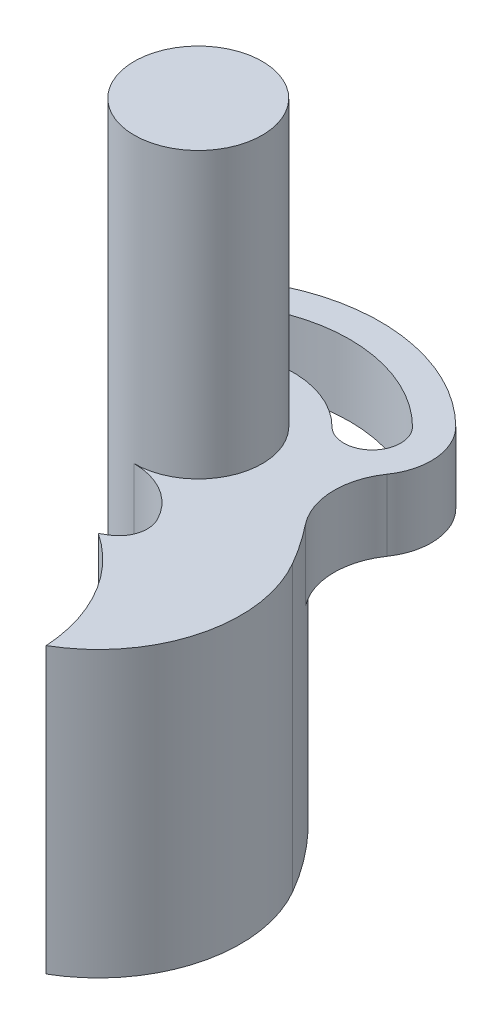
from build123d import *

# Parameters (mm, degrees)
SALIENTE_EXTRUIR1_DEPTH = 20
REDONDEO1_R             = 10
SALIENTE_EXTRUIR2_START = 20
CROQUIS1_4_R            = 4.5
SALIENTE_EXTRUIR2_DEPTH = 20
SALIENTE_EXTRUIR4_DEPTH = 5
REDONDEO4_R             = 5
REDONDEO5_R             = 2


with BuildPart() as part:
    # Croquis1 → Saliente-Extruir1 (new body)
    with BuildSketch(Plane(origin=(0, 0, 0), x_dir=(1, 0, 0), z_dir=(0, 1, 0))):
        with BuildLine():
            Line((4.71210557073282, 8.494038111608782), (2.980054763163943, 7.494038111608782))
            ThreePointArc((2.9800547631639436, 7.494038111608781), (6.495190528383288, 3.749999999999996), (7.9800547631639365, -1.1662159262356018))
            Line((7.980054763163938, -1.166215926235604), (16.640308801008324, 3.8337840737643942))
            Line((16.640308801008324, 3.833784073764395), (11.640308801008324, 12.49403811160878))
            ThreePointArc((11.640308801008327, 12.494038111608782), (7.486283619207324, 17.729429010253995), (1.992335720896067, 21.53492235058391))
            ThreePointArc((1.9923357208960657, 21.534922350583905), (-4.3821884132033615, 18.52294902668032), (2.49e-15, 13))
            ThreePointArc((4.3e-16, 13), (3.259893842188938, 11.692210023771297), (4.712105570732819, 8.494038111608784))
        make_face()
    extrude(amount=-SALIENTE_EXTRUIR1_DEPTH)

    # Redondeo1
    redondeo1_edges = [part.edges().sort_by_distance(p)[0] for p in [
        (16.640308801008324, -10, -3.8337840737643947),
    ]]
    fillet(redondeo1_edges, radius=REDONDEO1_R - 0.0001)  # a hair under: the kernel refuses the full size

    # Croquis1<4> → Saliente-Extruir2 (add)
    with BuildSketch(Plane(origin=(0, 0, 0), x_dir=(1, 0, 0), z_dir=(0, 1, 0)).offset(SALIENTE_EXTRUIR2_START)):
        with Locations(Location((4e-17, 17.5, 0), (0, 0, 270))):
            Circle(CROQUIS1_4_R)
    extrude(amount=-SALIENTE_EXTRUIR2_DEPTH)

    # Croquis2 → Saliente-Extruir4 (add)
    with BuildSketch(Plane(origin=(0, 0, 0), x_dir=(1, 0, 0), z_dir=(0, 1, 0))):
        with BuildLine():
            ThreePointArc((9.051706443450353, 26.551706443450232), (1.1156846733798031, 30.2523341701189), (-7.342378354819137, 27.986003012181577))
            ThreePointArc((-7.342378354819137, 27.986003012181577), (-8.36164556563995, 22.20545141012103), (-2.581093963579654, 21.186184199300502))
            ThreePointArc((-2.581093963579654, 21.186184199300502), (0.3922008423644143, 21.98287614141279), (3.181980515339327, 20.681980515339635))
            ThreePointArc((3.181980515339327, 20.681980515339635), (9.051706443449934, 20.681980515339355), (9.051706443450353, 26.551706443450232))
        make_face()
        with BuildLine():
            ThreePointArc((7.531057041767888, 25.031057041767813), (0.928254243367484, 28.109994551949146), (-6.108889031901341, 26.224397694318867))
            ThreePointArc((-6.108889031901341, 26.224397694318867), (-6.600040247777167, 23.438940733039082), (-3.814583286497142, 22.947789517162914))
            ThreePointArc((-3.814583286497142, 22.947789517162914), (0.579631272376833, 24.12521575958216), (4.702629917021658, 22.20262991702166))
            ThreePointArc((4.702629917021658, 22.20262991702166), (7.531057041767845, 22.20262991702162), (7.531057041767888, 25.031057041767813))
        make_face(mode=Mode.SUBTRACT)
    extrude(amount=-SALIENTE_EXTRUIR4_DEPTH)

    # Redondeo4
    redondeo4_edges = [part.edges().sort_by_distance(p)[0] for p in [
        (5.278570690107173, -2.5, -19.551853938657132),
        (-2.5810939635796544, -2.5, -21.1861841993005),
    ]]
    fillet(redondeo4_edges, radius=REDONDEO4_R)

    # Redondeo5
    redondeo5_edges = [part.edges().sort_by_distance(p)[0] for p in [
        (4.712105570732819, -10, -8.494038111608784),
    ]]
    fillet(redondeo5_edges, radius=REDONDEO5_R)


solid = part.part
